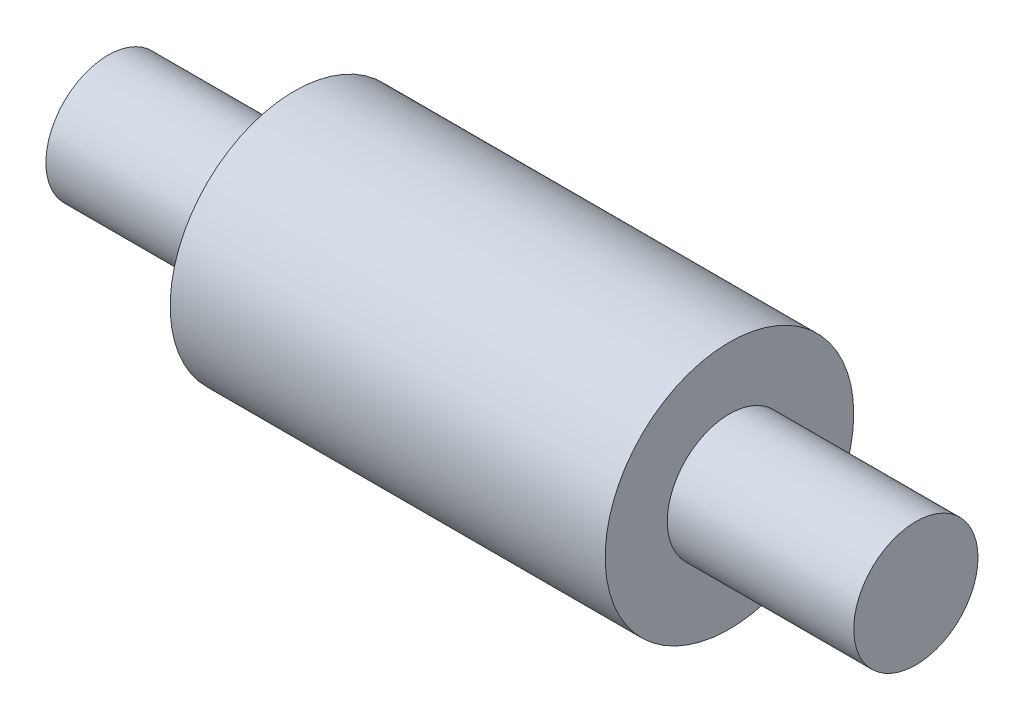
from build123d import *


with BuildPart() as part:
    # Sketch1 → Revolve1 (revolve)
    with BuildSketch(Plane(origin=(0, 0, 0), x_dir=(1, 0, 0), z_dir=(0, 1, 0))):
        Polygon((0, 0), (0, 10), (30, 10), (30, 20), (100, 20), (100, 10), (130, 10), (130, 0), align=None)
    revolve(axis=Axis((130, 0, 0), (-1, 0, 0)))


solid = part.part
